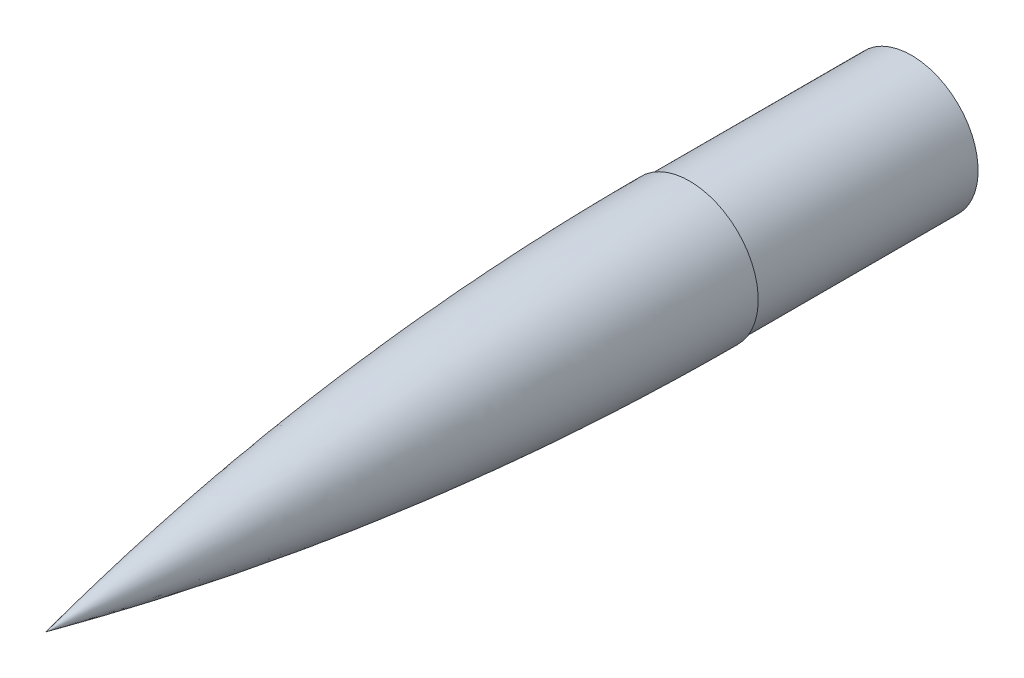
from build123d import *

# Parameters (mm, degrees)
SKETCH3_R                       = 38.1
SKETCH3_R_2                     = 36.5125
BOSS_EXTRUDE1_DEPTH             = 127
BOSS_EXTRUDE1_DIRECTION_2_REACH = 1788.162


# Read off the part's stored shape, not the designer's step: Shell1
with BuildPart() as part:
    # Sketch2 → Revolve1 (revolve)
    with BuildSketch(Plane(origin=(0, 0, 0), x_dir=(0, 0, -1), z_dir=(1, 0, 0))):
        with BuildLine():
            Line((0, 1708.081629133), (0, 1747.337329133))
            ThreePointArc((0, 1747.337329133), (-185.193074913, 1737.495688278), (-368.3, 1708.081629133))
            Line((-368.3, 1708.081629133), (0, 1708.081629133))
        make_face()
    revolve(axis=Axis((0, 1708.081629133, 0), (0, 0, 1)))

    # Shell1 outline → Shell1 (revolve, cut)
    with BuildSketch(Plane.XZ.offset(-1708.081629133)):
        with BuildLine():
            add(Edge.make_bspline(
                [(0, 362.777383722), (38.1, 183.38938163), (38.1, 0)],
                knots=[6.073906326, 6.073906326, 6.073906326, 6.283185307, 6.283185307, 6.283185307], degree=2, weights=[1, 0.994530282, 1]))
            Line((0, 362.777383722), (0, 0))
            Line((0, 0), (38.1, 0))
        make_face()
    revolve(axis=Axis((0, 1708.081629133, 0), (0, 0, 1)), mode=Mode.SUBTRACT)

    # Sketch3 → Boss-Extrude1 (add)
    with BuildSketch(Plane(origin=(0, 0, 0), x_dir=(-1, 0, 0), z_dir=(0, 0, -1))):
        with Locations((0, 1708.081629133)):
            Circle(SKETCH3_R)
        with Locations((0, 1708.081629133)):
            Circle(SKETCH3_R_2, mode=Mode.SUBTRACT)
    extrude(amount=BOSS_EXTRUDE1_DEPTH)

    # Sketch3 → Boss-Extrude1 direction 2 (add, up to next)
    with BuildSketch(Plane(origin=(0, 0, 0), x_dir=(-1, 0, 0), z_dir=(0, 0, -1)), mode=Mode.PRIVATE) as boss_extrude1_direction_2_sk1:
        with Locations((0, 1708.081629133)):
            Circle(SKETCH3_R)
        with Locations((0, 1708.081629133)):
            Circle(SKETCH3_R_2, mode=Mode.SUBTRACT)
    boss_extrude1_direction_2_tool1 = extrude(boss_extrude1_direction_2_sk1.sketch, amount=-BOSS_EXTRUDE1_DIRECTION_2_REACH, mode=Mode.PRIVATE) - part.part
    add(boss_extrude1_direction_2_tool1.solids().sort_by_distance((37.022369, 1708.081629, 0))[0])


solid = part.part
